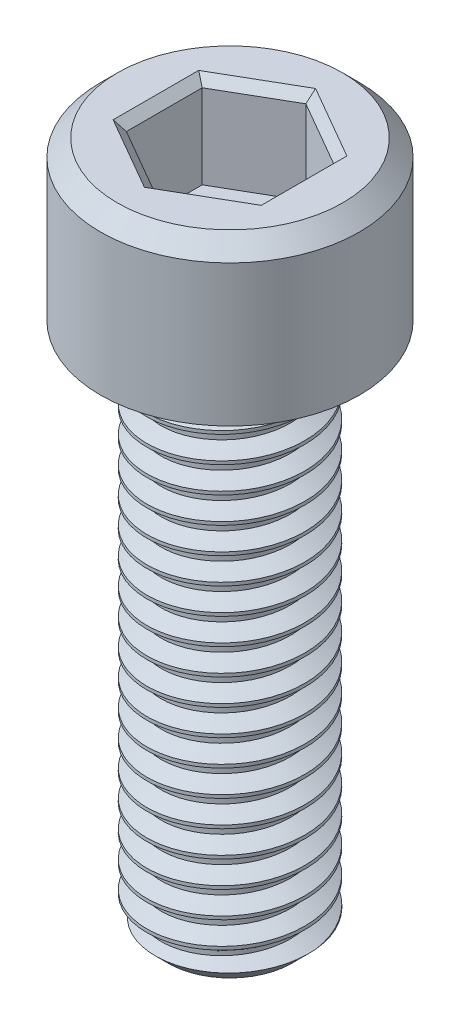
from build123d import *
from build123d.topology import SkipClean

# Parameters (mm, degrees)
SKETCH1_W           = 3.9116
SKETCH1_H           = 4.7752
SKETCH2_R           = 2.3876
BOSS_EXTRUDE1_DEPTH = 15.875
CUT_EXTRUDE1_DEPTH  = 2.794
CHAMFER1_SIZE       = 0.508
CHAMFER2_SIZE       = 0.254
THREAD1_PITCH       = 0.79375


with BuildPart() as part:
    # Sketch1 → Revolve1 (revolve)
    with BuildSketch(Plane(origin=(0, 0, 0), x_dir=(-1, 0, 0), z_dir=(0, 0, -1)), mode=Mode.PRIVATE) as revolve1_sk:
        with Locations((-1.9558, -2.3876)):
            Rectangle(SKETCH1_W, SKETCH1_H)
    revolve(revolve1_sk.sketch.rotate(Axis((0, -4.7752, 0), (0, 1, 0)), 270), axis=Axis((0, -4.7752, 0), (0, 1, 0)))

    # Sketch2 → Boss-Extrude1 (add)
    with BuildSketch(Plane.XZ.offset(4.7752)):
        with Locations(Location((0, 0, 0), (0, 0, 270))):
            Circle(SKETCH2_R)
    extrude(amount=BOSS_EXTRUDE1_DEPTH)

    # Sketch3 → Cut-Extrude1 (cut)
    with BuildSketch(Plane(origin=(0, 0, 0), x_dir=(-1, 0, 0), z_dir=(0, 1, 0))):
        Polygon((1.984375, -1.14567944), (1.984375, 1.14567944), (0, 2.291358881), (-1.984375, 1.14567944), (-1.984375, -1.14567944), (0, -2.291358881), align=None)
    extrude(amount=-CUT_EXTRUDE1_DEPTH, mode=Mode.SUBTRACT)

    # Chamfer1
    chamfer1_edges = [part.edges().sort_by_distance(p)[0] for p in [
        (0, 0, -3.9116),
        (0, -20.6502, 2.3876),
    ]]
    chamfer(chamfer1_edges, length=CHAMFER1_SIZE)

    # Chamfer2
    chamfer2_edges = [part.edges().sort_by_distance(p)[0] for p in [
        (-0.9921875, 0, -1.718519161),
        (-1.984375, 0, 0),
        (-0.9921875, 0, 1.718519161),
        (0.9921875, 0, 1.718519161),
        (1.984375, 0, 0),
        (0.9921875, 0, -1.718519161),
    ]]
    chamfer(chamfer2_edges, length=CHAMFER2_SIZE)

    # Thread1: the profile of Thread Profile1 profile screwed along a right-hand helix of 19.36 turns, 8 arcs to a turn; built about Z, then put on its axis
    with SkipClean():  # the faces are left unmerged after this step: merging them gives an invalid solid
        thread1_z = Axis((0, 0, 0), (0, 0, 1))
        thread1_corners = [(2.3879, 0, -0.000173205), (2.3879, 0, 0.694704453), (1.957970212, 0, 0.446484374), (1.957970212, 0, 0.248046874)]
        with BuildLine(mode=Mode.PRIVATE) as thread1_profile:
            Line(thread1_corners[0], thread1_corners[1])
            Line(thread1_corners[1], thread1_corners[2])
            Line(thread1_corners[2], thread1_corners[3])
            Line(thread1_corners[3], thread1_corners[0])
        thread1_cap = Face(thread1_profile.wire())
        thread1_turn_angles = [0, 22.5, 45, 67.5, 90, 112.5, 135, 157.5, 180, 202.5, 225, 247.5, 270, 292.5, 315, 337.5, 360]
        thread1_turn_weights = [1, 0.9238795325112867, 1, 0.9238795325112867, 1, 0.9238795325112867, 1, 0.9238795325112867, 1, 0.9238795325112867, 1, 0.9238795325112867, 1, 0.9238795325112867, 1, 0.9238795325112867, 1]
        thread1_turn_rails = [Edge.make_bspline([Vector(p[0], p[1], 0).rotate(thread1_z, thread1_turn_angles[k]) / thread1_turn_weights[k] + Vector(0, 0, p[2] + THREAD1_PITCH * thread1_turn_angles[k] / 360) for k in range(17)], [0, 0, 0, 1, 1, 2, 2, 3, 3, 4, 4, 5, 5, 6, 6, 7, 7, 8, 8, 8], 2, thread1_turn_weights) for p in thread1_corners]
        thread1_turn_sides = [Face.make_surface_from_curves(thread1_turn_rails[p[0]], thread1_turn_rails[p[1]]) for p in [(0, 1), (1, 2), (2, 3), (3, 0)]]
        thread1_last_angles = [6840, 6862.5, 6885, 6907.5, 6930, 6949.8, 6969.6]
        thread1_last_weights = [1, 0.9238795325112867, 1, 0.9238795325112867, 1, 0.9408807689543911, 1]
        thread1_last_rails = [Edge.make_bspline([Vector(p[0], p[1], 0).rotate(thread1_z, thread1_last_angles[k]) / thread1_last_weights[k] + Vector(0, 0, p[2] + THREAD1_PITCH * thread1_last_angles[k] / 360) for k in range(7)], [0, 0, 0, 1, 1, 2, 2, 3, 3, 3], 2, thread1_last_weights) for p in thread1_corners]
        thread1_last_sides = [Face.make_surface_from_curves(thread1_last_rails[p[0]], thread1_last_rails[p[1]]) for p in [(0, 1), (1, 2), (2, 3), (3, 0)]]
        thread1 = Plane(origin=(0, -4.7752, 0), x_dir=(-1, 0, 0), z_dir=(0, -1, 0)) * Solid(Shell([*[p.moved(Location((0, 0, THREAD1_PITCH * i))) for i in range(19) for p in thread1_turn_sides], *thread1_last_sides, thread1_cap, thread1_cap.rotate(thread1_z, 6969.6).moved(Location((0, 0, THREAD1_PITCH * 6969.6 / 360)))]))
        add(thread1, mode=Mode.SUBTRACT)


solid = part.part
